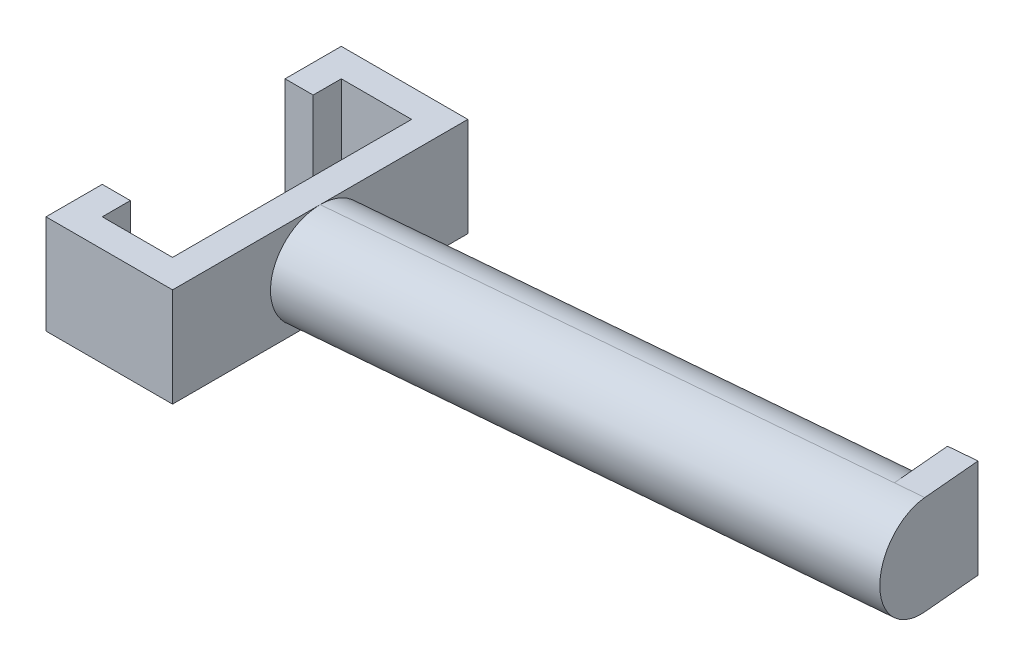
from build123d import *

# Parameters (mm, degrees)
BOSS_EXTRUDE1_DEPTH = 5.588
FILLET1_R           = 2.794
BOSS_EXTRUDE2_DEPTH = 1.5875


with BuildPart() as part:
    # Sketch1 → Boss-Extrude1 (new body)
    with BuildSketch(Plane(origin=(0, 0, 0), x_dir=(1, 0, 0), z_dir=(0, 1, 0))):
        Polygon((0, 0), (7.14375, 0), (7.14375, 5.529702374), (38.772931664, 8.296897206), (38.285905374, 13.863633179), (7.14375, 11.139047626), (7.14375, 16.66875), (0, 16.66875), (0, 13.49375), (1.5875, 13.49375), (1.5875, 15.08125), (5.55625, 15.08125), (5.55625, 1.5875), (1.5875, 1.5875), (1.5875, 3.175), (0, 3.175), align=None)
    extrude(amount=BOSS_EXTRUDE1_DEPTH)

    # Fillet1
    fillet1_edges = [part.edges().sort_by_distance(p)[0] for p in [
        (22.958340832, 0, -6.91329979),
        (22.714827687, 0, -12.501340403),
        (22.958340832, 5.588, -6.91329979),
        (22.714827687, 5.588, -12.501340403),
    ]]
    fillet(fillet1_edges, radius=FILLET1_R - 0.0001)  # a hair under: the kernel refuses the full size

    # Sketch2 → Boss-Extrude2 (add)
    with BuildSketch(Plane(origin=(39.198778227, 0, -3.429448719), x_dir=(-0.08715574274766254, 0, -0.9961946980917452), z_dir=(0.9961946980917452, 0, -0.08715574274766254))):
        with BuildLine():
            Line((7.68004135, 5.588), (10.98204135, 5.588))
            Line((10.98204135, 5.588), (10.98204135, 0))
            Line((10.98204135, 0), (7.68004135, 0))
            ThreePointArc((7.68004135, 0), (4.88604135, 2.794), (7.68004135, 5.588))
        make_face()
    extrude(amount=-BOSS_EXTRUDE2_DEPTH)


solid = part.part
